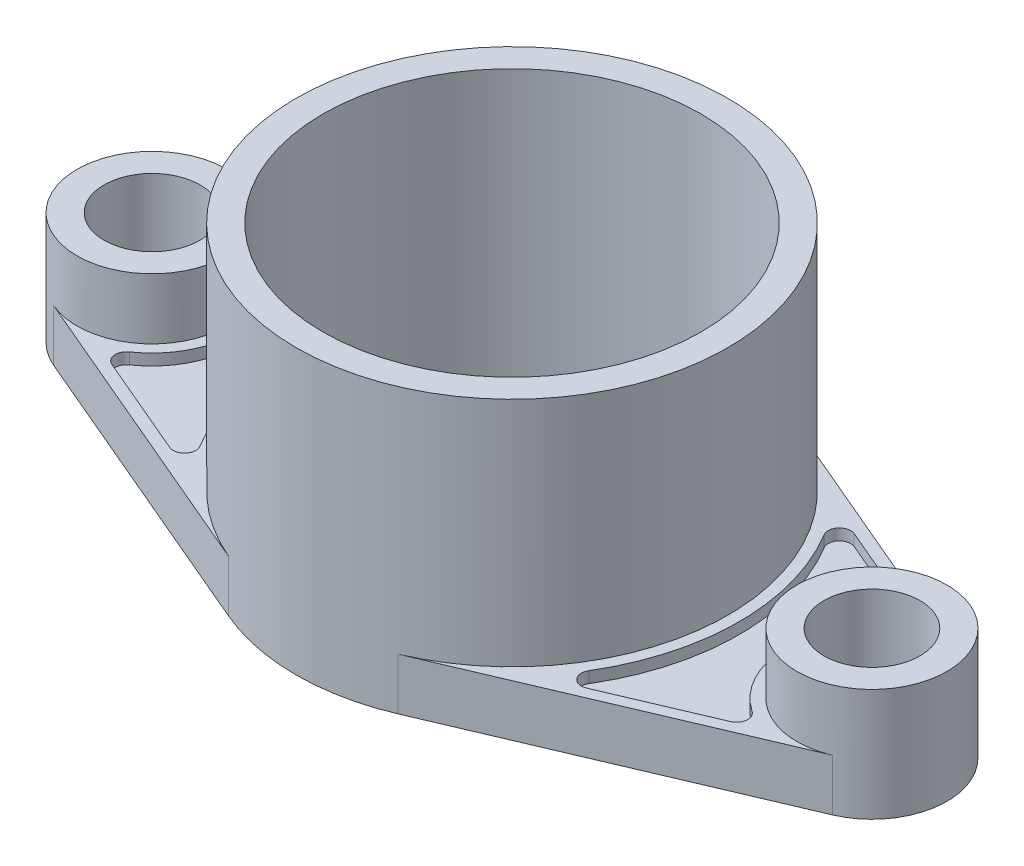
from build123d import *

# Parameters (mm, degrees)
SKETCH1_R           = 48
SKETCH1_R_2         = 42
BOSS_EXTRUDE1_DEPTH = 63
SKETCH2_R           = 16.666666667
SKETCH2_R_2         = 10.666666667
BOSS_EXTRUDE2_DEPTH = 25
BOSS_EXTRUDE3_DEPTH = 9
BOSS_EXTRUDE4_DEPTH = 2.5
FILLET1_R           = 2.5
MIRROR3_DEPTH       = 9
MIRROR3_START       = 9
MIRROR3_2_DEPTH     = 2.5


# Read off the part's stored shape, not the designer's step: Mirror3
with BuildPart() as part:
    # Sketch1 → Boss-Extrude1 (new body)
    with BuildSketch(Plane(origin=(0, 0, 0), x_dir=(1, 0, 0), z_dir=(0, 1, 0))):
        with Locations(Location((0, 0, 0), (0, 0, 270))):
            Circle(SKETCH1_R)
        with Locations(Location((0, 0, 0), (0, 0, 270))):
            Circle(SKETCH1_R_2, mode=Mode.SUBTRACT)
    extrude(amount=BOSS_EXTRUDE1_DEPTH)



with BuildPart() as body_2:
    # Sketch2 → Boss-Extrude2 (new body)
    with BuildSketch(Plane(origin=(0, 0, 0), x_dir=(1, 0, 0), z_dir=(0, 1, 0))):
        with Locations(Location((-80, 0, 0), (0, 0, 270))):
            Circle(SKETCH2_R)
        with Locations(Location((-80, 0, 0), (0, 0, 270))):
            Circle(SKETCH2_R_2, mode=Mode.SUBTRACT)
    boss_extrude2 = extrude(amount=BOSS_EXTRUDE2_DEPTH)


with BuildPart() as part_1:
    add(part.part)

    add(body_2.part)  # Boss-Extrude3 merges body 2
    # Sketch3 → Boss-Extrude3 (add)
    with BuildSketch(Plane(origin=(0, 0, 0), x_dir=(1, 0, 0), z_dir=(0, 1, 0))):
        with BuildLine():
            Line((-86.527777778, 15.335119662), (-18.8, 44.165144628))
            ThreePointArc((-18.8, 44.165144628), (-48, 0), (-18.8, -44.165144628))
            Line((-18.8, -44.165144628), (-86.527777778, -15.335119662))
            ThreePointArc((-86.527777778, -15.335119662), (-63.333333333, 0), (-86.527777778, 15.335119662))
        make_face()
    extrude(amount=BOSS_EXTRUDE3_DEPTH)

    # Sketch5 → Boss-Extrude4 (add)
    with BuildSketch(Plane(origin=(0, 9, 0), x_dir=(1, 0, 0), z_dir=(0, 1, 0))):
        with BuildLine():
            Line((-86.527777778, -15.335119662), (-18.8, -44.165144628))
            ThreePointArc((-18.8, -44.165144628), (-48, 0), (-18.8, 44.165144628))
            Line((-18.8, 44.165144628), (-86.527777778, 15.335119662))
            ThreePointArc((-86.527777778, 15.335119662), (-63.333333333, 0), (-86.527777778, -15.335119662))
        make_face()
        with BuildLine():
            Line((-37.97937164, 33.283889944), (-73.670078498, 18.091246637))
            ThreePointArc((-73.670078498, 18.091246637), (-60.833333333, 0), (-73.670078498, -18.091246637))
            Line((-73.670078498, -18.091246637), (-37.97937164, -33.283889944))
            ThreePointArc((-37.97937164, -33.283889944), (-50.5, 0), (-37.97937164, 33.283889944))
        make_face(mode=Mode.SUBTRACT)
    extrude(amount=BOSS_EXTRUDE4_DEPTH)

    # Fillet1
    fillet1_edges = [part_1.edges().sort_by_distance(p)[0] for p in [
        (-37.97937164, 10.25, -33.283889944),
        (-73.670078498, 10.25, -18.091246637),
        (-73.670078498, 10.25, 18.091246637),
        (-37.97937164, 10.25, 33.283889944),
    ]]
    fillet(fillet1_edges, radius=FILLET1_R)

    # Mirror3 outline → Mirror3 (add)
    with BuildSketch(Plane(origin=(0, 0, 0), x_dir=(1, 0, 0), z_dir=(0, 1, 0))):
        with BuildLine():
            Line((18.8, -44.165144628), (86.527777778, -15.335119662))
            ThreePointArc((86.527777778, -15.335119662), (63.333333333, 0), (86.527777778, 15.335119662))
            Line((86.527777778, 15.335119662), (18.8, 44.165144628))
            ThreePointArc((18.8, 44.165144628), (48, 0), (18.8, -44.165144628))
        make_face()
    extrude(amount=MIRROR3_DEPTH)

    # Mirror3 2 outline → Mirror3 2 (add)
    with BuildSketch(Plane(origin=(0, 0, 0), x_dir=(1, 0, 0), z_dir=(0, 1, 0)).offset(MIRROR3_START)):
        with BuildLine():
            Line((18.8, -44.165144628), (86.527777778, -15.335119662))
            ThreePointArc((86.527777778, -15.335119662), (63.333333333, 0), (86.527777778, 15.335119662))
            Line((86.527777778, 15.335119662), (18.8, 44.165144628))
            ThreePointArc((18.8, 44.165144628), (48, 0), (18.8, -44.165144628))
        make_face()
        with BuildLine():
            ThreePointArc((43.210987158, -26.135427849), (50.5, 0), (43.210987158, 26.135427849))
            ThreePointArc((43.210987158, 26.135427849), (43.461816214, 29.067618208), (46.329311604, 29.72952886))
            Line((46.329311604, 29.72952886), (68.749829189, 20.185673992))
            ThreePointArc((68.749829189, 20.185673992), (70.258507425, 18.131633045), (69.181739923, 15.821705345))
            ThreePointArc((69.181739923, 15.821705345), (60.833333333, 0), (69.181739923, -15.821705345))
            ThreePointArc((69.181739923, -15.821705345), (70.258507425, -18.131633045), (68.749829189, -20.185673992))
            Line((68.749829189, -20.185673992), (46.329311604, -29.72952886))
            ThreePointArc((46.329311604, -29.72952886), (43.461816214, -29.067618208), (43.210987158, -26.135427849))
        make_face(mode=Mode.SUBTRACT)
    extrude(amount=MIRROR3_2_DEPTH)

    # Mirror4: Boss-Extrude2 across plane
    add(boss_extrude2.mirror(Plane(origin=(0, 0, 0), x_dir=(0, 0, 1), z_dir=(1, 0, 0))))


solid = part_1.part
